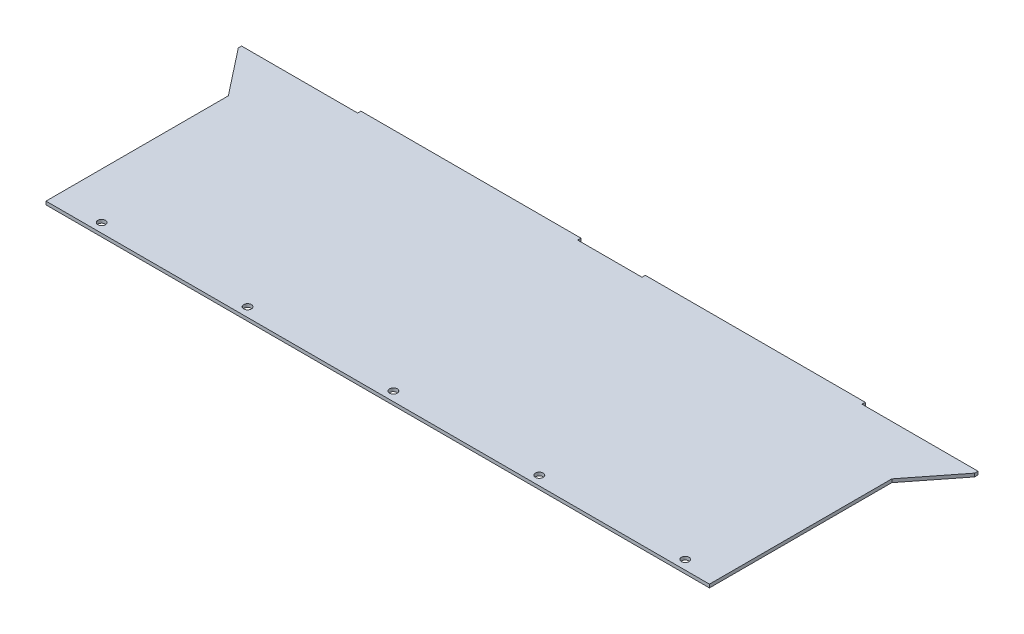
from build123d import *

# Parameters (mm, degrees)
SKETCH1_W           = 635.3556
SKETCH1_H           = 222.25
BOSS_EXTRUDE1_DEPTH = 1.5875
SKETCH2_W           = 210.6549
SKETCH2_H           = 3.175
BOSS_EXTRUDE2_DEPTH = 3.175
BOSS_EXTRUDE3_DEPTH = 3.175
SKETCH4_R           = 3.675
CUT_EXTRUDE1_DEPTH  = 10
LPATTERN1_COUNT     = 5
LPATTERN1_PITCH     = 139.7


with BuildPart() as part:
    # Sketch1 → Boss-Extrude1 (new, symmetric)
    with BuildSketch(Plane(origin=(0, 0, 0), x_dir=(1, 0, 0), z_dir=(0, 1, 0))):
        Rectangle(SKETCH1_W, SKETCH1_H)
    extrude(amount=BOSS_EXTRUDE1_DEPTH, both=True)

    # Sketch2 → Boss-Extrude2 (add)
    with BuildSketch(Plane(origin=(0, 0, -111.125), x_dir=(-1, 0, 0), z_dir=(0, 0, -1))):
        with Locations((136.15035, 0)):
            Rectangle(SKETCH2_W, SKETCH2_H)
        with Locations((-136.15035, 0)):
            Rectangle(SKETCH2_W, SKETCH2_H)
    extrude(amount=BOSS_EXTRUDE2_DEPTH)

    # Sketch3 → Boss-Extrude3 (add)
    with BuildSketch(Plane(origin=(0, 1.5875, 0), x_dir=(1, 0, 0), z_dir=(0, 1, 0))):
        Polygon((-317.6778, 63.5), (-317.6778, 111.125), (-352.6028, 111.125), (-352.6028, 107.95), align=None)
    boss_extrude3 = extrude(amount=-BOSS_EXTRUDE3_DEPTH)

    # Mirror1: Boss-Extrude3 across plane
    add(boss_extrude3.mirror(Plane(origin=(0, 0, 0), x_dir=(0, 0, 1), z_dir=(1, 0, 0))))

    # Sketch4 → Cut-Extrude1 (cut)
    with BuildSketch(Plane(origin=(0, 1.5875, 0), x_dir=(1, 0, 0), z_dir=(0, 1, 0))):
        with Locations((-273.2278, -102.235)):
            Circle(SKETCH4_R)
    cut_extrude1 = extrude(amount=-CUT_EXTRUDE1_DEPTH, mode=Mode.SUBTRACT)

    # LPattern1: Cut-Extrude1 ×5
    with Locations(*[(i * LPATTERN1_PITCH, 0, 0) for i in range(1, LPATTERN1_COUNT)]):
        add(cut_extrude1, mode=Mode.SUBTRACT)


solid = part.part
